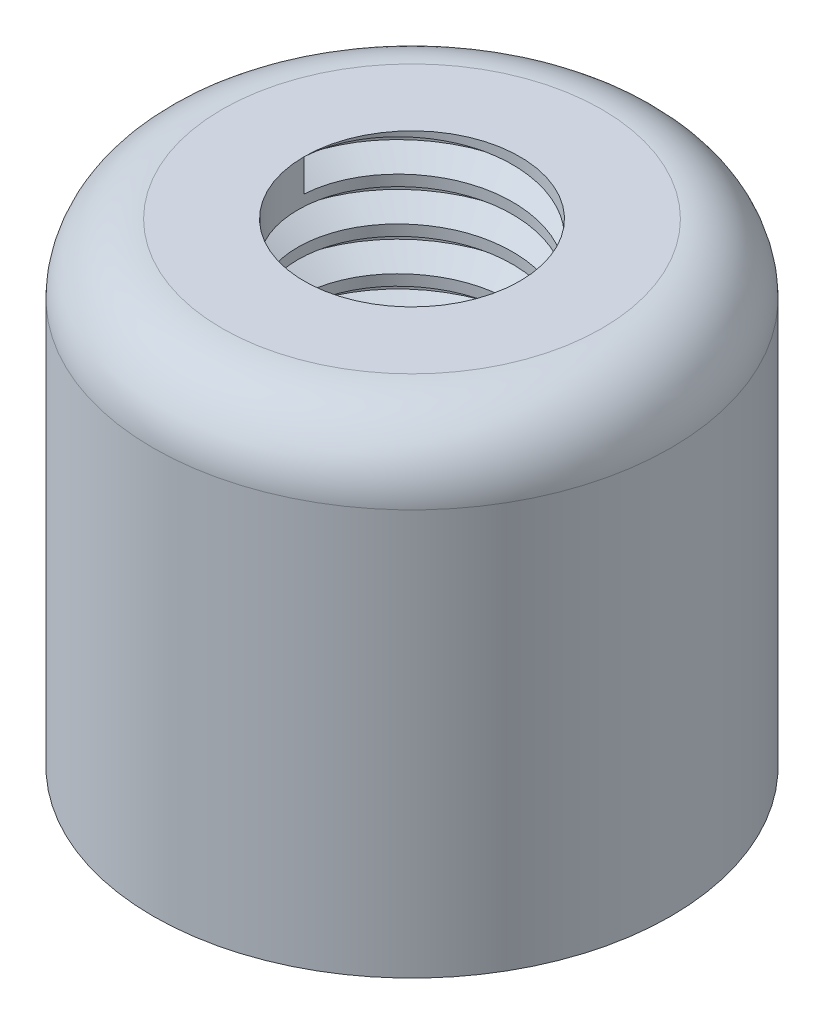
from build123d import *
from build123d.topology import SkipClean

# Parameters (mm, degrees)
SZKIC1_R                    = 3
DODANIE_WYCI_GNI_CIE1_DEPTH = 5.5
SZKIC2_R                    = 1.25
WYTNIJ_WYCI_GNI_CIE1_DEPTH  = 5
ZAOKR_GLENIE1_R             = 0.8
GWINT1_PITCH                = 0.5


with BuildPart() as part:
    # Szkic1 → Dodanie-wyciągnięcie1 (new body)
    with BuildSketch(Plane(origin=(0, 0, 0), x_dir=(1, 0, 0), z_dir=(0, 1, 0))):
        with Locations(Location((0, 0, 0), (0, 0, 270))):
            Circle(SZKIC1_R)
    extrude(amount=DODANIE_WYCI_GNI_CIE1_DEPTH)

    # Szkic2 → Wytnij-wyciągnięcie1 (cut)
    with BuildSketch(Plane(origin=(0, 5.5, 0), x_dir=(1, 0, 0), z_dir=(0, 1, 0))):
        with Locations(Location((0, 0, 0), (0, 0, 270))):
            Circle(SZKIC2_R)
    extrude(amount=-WYTNIJ_WYCI_GNI_CIE1_DEPTH, mode=Mode.SUBTRACT)

    # Zaokrąglenie1
    zaokr_glenie1_edges = [part.edges().sort_by_distance(p)[0] for p in [
        (0, 5.5, -3),
    ]]
    fillet(zaokr_glenie1_edges, radius=ZAOKR_GLENIE1_R)

    # Gwint1: the profile of Profil gwintu1 profile screwed along a right-hand helix of 10 turns, 6 arcs to a turn; built about Z, then put on its axis
    with SkipClean():  # the faces are left unmerged after this step: merging them gives an invalid solid
        gwint1_z = Axis((0, 0, 0), (0, 0, 1))
        gwint1_corners = [(1.2497, 0, -0.000173205), (1.520632938, 0, 0.156249999), (1.520632937, 0, 0.218749999), (1.2497, 0, 0.375173204)]
        with BuildLine(mode=Mode.PRIVATE) as gwint1_profile:
            Line(gwint1_corners[0], gwint1_corners[1])
            Line(gwint1_corners[1], gwint1_corners[2])
            Line(gwint1_corners[2], gwint1_corners[3])
            Line(gwint1_corners[3], gwint1_corners[0])
        gwint1_cap = Face(gwint1_profile.wire())
        gwint1_turn_angles = [0, 30, 60, 90, 120, 150, 180, 210, 240, 270, 300, 330, 360]
        gwint1_turn_weights = [1, 0.8660254037844387, 1, 0.8660254037844387, 1, 0.8660254037844387, 1, 0.8660254037844387, 1, 0.8660254037844387, 1, 0.8660254037844387, 1]
        gwint1_turn_rails = [Edge.make_bspline([Vector(p[0], p[1], 0).rotate(gwint1_z, gwint1_turn_angles[k]) / gwint1_turn_weights[k] + Vector(0, 0, p[2] + GWINT1_PITCH * gwint1_turn_angles[k] / 360) for k in range(13)], [0, 0, 0, 1, 1, 2, 2, 3, 3, 4, 4, 5, 5, 6, 6, 6], 2, gwint1_turn_weights) for p in gwint1_corners]
        gwint1_turn_sides = [Face.make_surface_from_curves(gwint1_turn_rails[p[0]], gwint1_turn_rails[p[1]]) for p in [(0, 1), (1, 2), (2, 3), (3, 0)]]
        gwint1 = Plane(origin=(0, 5.5, 0), x_dir=(-1, 0, 0), z_dir=(0, -1, 0)) * Solid(Shell([*[p.moved(Location((0, 0, GWINT1_PITCH * i))) for i in range(10) for p in gwint1_turn_sides], gwint1_cap, gwint1_cap.rotate(gwint1_z, 3600).moved(Location((0, 0, GWINT1_PITCH * 3600 / 360)))]))
        add(gwint1, mode=Mode.SUBTRACT)


solid = part.part
